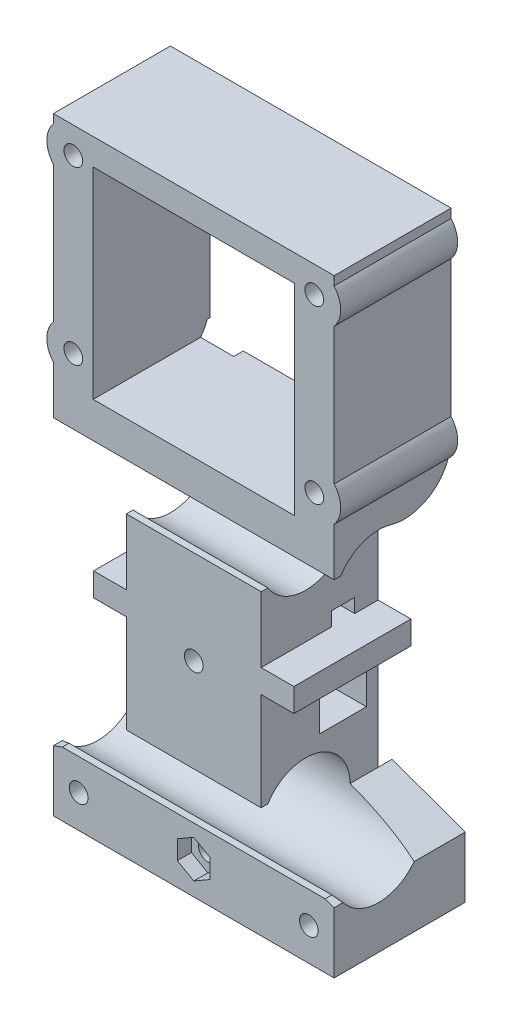
from build123d import *

# Parameters (mm, degrees)
SKETCH_1_W          = 60
SKETCH_1_H          = 130
EXTRUDE_1_DEPTH     = 25
SKETCH_2_W          = 43
SKETCH_2_H          = 43
CUT_EXTRUDE_1_DEPTH = 76.828754441
SKETCH_3_W          = 10
SKETCH_3_H          = 8
CUT_EXTRUDE_2_DEPTH = 92.923881554
FILLET_1_R          = 20
FILLET_2_R          = 10
SKETCH_4_R          = 2
CUT_EXTRUDE_3_DEPTH = 76.828754441
EXTRUDE_2_REACH     = 77.829
SKETCH_5_R          = 4.25
SKETCH_5_R_2        = 2
SKETCH_6_R          = 2
EXTRUDE_3_DEPTH     = 25
CUT_EXTRUDE_4_DEPTH = 5
SKETCH_8_R          = 2
CUT_EXTRUDE_5_DEPTH = 20
CUT_EXTRUDE_6_DEPTH = 3
SKETCH_11_W         = 7
SKETCH_11_H         = 5
EXTRUDE_5_DEPTH     = 7
SKETCH_12_W         = 7
SKETCH_12_H         = 5
EXTRUDE_6_DEPTH     = 7
SKETCH_13_W         = 7
SKETCH_13_H         = 5
EXTRUDE_7_DEPTH     = 4
SKETCH_17_W         = 7
SKETCH_17_H         = 5
EXTRUDE_8_DEPTH     = 14
EXTRUDE_9_DEPTH     = 3
SKETCH_19_W         = 5
SKETCH_19_H         = 3
CUT_EXTRUDE_7_DEPTH = 84.352504546
SKETCH_20_W         = 15
SKETCH_20_H         = 10
CUT_EXTRUDE_8_DEPTH = 13


with BuildPart() as part:
    # Эскиз1 → Бобышка-Вытянуть1 (new body)
    with BuildSketch(Plane.XY):
        Rectangle(SKETCH_1_W, SKETCH_1_H)
    extrude(amount=EXTRUDE_1_DEPTH)

    # Эскиз2 → Вырез-Вытянуть1 (cut, through all)
    with BuildSketch(Plane(origin=(0, 0, 0), x_dir=(-1, 0, 0), z_dir=(0, 0, -1))):
        Polygon((-30, 3.7), (-14.4, 3.7), (-14.4, -46.3), (-30, -52), align=None)
        with Locations((0, 37.85)):
            Rectangle(SKETCH_2_W, SKETCH_2_H)
        Polygon((14.4, -46.3), (30, -52), (30, 3.7), (14.4, 3.7), align=None)
    extrude(amount=-CUT_EXTRUDE_1_DEPTH, mode=Mode.SUBTRACT)

    # Эскиз3 → Вырез-Вытянуть2 (cut, through all)
    with BuildSketch(Plane.ZY.offset(30)):
        with BuildLine():
            Line((23.577747211, 8.7), (25, 8.7))
            Line((25, 8.7), (25, 3.7))
            Line((25, 3.7), (25, -1.3))
            Line((25, -1.3), (23.577747211, -1.3))
            ThreePointArc((23.577747211, -1.3), (6, 3.7), (23.577747211, 8.7))
        make_face()
        with BuildLine():
            Line((25, -41.3), (23.577747211, -41.3))
            ThreePointArc((23.577747211, -41.3), (10.144669889, -38.453316662), (7.9, -52))
            Line((7.9, -52), (23.1, -52))
            ThreePointArc((23.1, -52), (23.346683338, -51.655330111), (23.577747211, -51.3))
            Line((23.577747211, -51.3), (25, -51.3))
            Line((25, -51.3), (25, -46.3))
            Line((25, -46.3), (25, -41.3))
        make_face()
        with Locations((7.5, -29.85)):
            Rectangle(SKETCH_3_W, SKETCH_3_H)
        with BuildLine():
            Line((23.1, -52), (7.9, -52))
            ThreePointArc((7.9, -52), (15.5, -55.8), (23.1, -52))
        make_face()
    extrude(amount=-CUT_EXTRUDE_2_DEPTH, mode=Mode.SUBTRACT)

    # Скругление1
    # the kernel refuses this fillet: 20 mm, written as the material it takes off along each edge
    with BuildSketch(Plane(origin=(-65.707142143, 3.7, 0), x_dir=(0, 1, 0), z_dir=(1, 0, 0))) as fillet_1_piece_1:
        with BuildLine():
            CenterArc((14.282856857, 20), FILLET_1_R, 224.427004001, 45.572995999)
            Line((0, 6), (-0.285657137, 5.72))
            ThreePointArc((-0.285657137, 5.72), (-0.4, 3), (-0.4, 0))
            Line((-0.4, 0), (0, -0.4))
            Line((0, -0.4), (14.282856857, -0.4))
            Line((14.282856857, -0.4), (14.282856857, 0))
        make_face()
    extrude(amount=51.307142143, mode=Mode.SUBTRACT)
    with BuildSketch(Plane(origin=(-65.707142143, 3.7, 0), x_dir=(0, 1, 0), z_dir=(1, 0, 0))) as fillet_1_piece_2_section:
        with BuildLine():
            CenterArc((14.282856857, 20), FILLET_1_R, 224.427004001, 45.572995999)
            Line((0, 6), (-0.285657137, 5.72))
            ThreePointArc((-0.285657137, 5.72), (-0.4, 3), (-0.4, 0))
            Line((-0.4, 0), (0, -0.4))
            Line((0, -0.4), (14.282856857, -0.4))
            Line((14.282856857, -0.4), (14.282856857, 0))
        make_face()
    fillet_1_piece_2 = extrude(amount=87.014284285, mode=Mode.PRIVATE)
    fillet_1_piece_2 = split(fillet_1_piece_2, bisect_by=Plane(origin=(14.4, 3.7, 0), z_dir=(1, 0, 0)), keep=Keep.TOP, mode=Mode.PRIVATE)
    add(fillet_1_piece_2, mode=Mode.SUBTRACT)
    with BuildSketch(Plane(origin=(65.707142143, 3.7, 0), x_dir=(0, 1, 0), z_dir=(-1, 0, 0))) as fillet_1_piece_3:
        with BuildLine():
            CenterArc((14.282856857, -20), FILLET_1_R, 90, 45.572995999)
            Line((0, -6), (-0.285657137, -5.72))
            ThreePointArc((-0.285657137, -5.72), (-0.4, -3), (-0.4, 0))
            Line((-0.4, 0), (0, 0.4))
            Line((0, 0.4), (14.282856857, 0.4))
            Line((14.282856857, 0.4), (14.282856857, 0))
        make_face()
    extrude(amount=51.307142143, mode=Mode.SUBTRACT)
    with BuildSketch(Plane(origin=(65.707142143, 3.7, 0), x_dir=(0, 1, 0), z_dir=(-1, 0, 0))) as fillet_1_piece_4_section:
        with BuildLine():
            CenterArc((14.282856857, -20), FILLET_1_R, 90, 45.572995999)
            Line((0, -6), (-0.285657137, -5.72))
            ThreePointArc((-0.285657137, -5.72), (-0.4, -3), (-0.4, 0))
            Line((-0.4, 0), (0, 0.4))
            Line((0, 0.4), (14.282856857, 0.4))
            Line((14.282856857, 0.4), (14.282856857, 0))
        make_face()
    fillet_1_piece_4 = extrude(amount=87.014284285, mode=Mode.PRIVATE)
    fillet_1_piece_4 = split(fillet_1_piece_4, bisect_by=Plane(origin=(-14.4, 3.7, 0), z_dir=(-1, 0, 0)), keep=Keep.TOP, mode=Mode.PRIVATE)
    add(fillet_1_piece_4, mode=Mode.SUBTRACT)

    # Скругление2
    # the kernel refuses this fillet: 10 mm, written as the material it takes off along each edge
    with BuildSketch(Plane(origin=(-79.117206761, 3.7, 6), x_dir=(-2.6805272160388098e-14, 0.8006407690254324, 0.5991446895152824), z_dir=(1, 0, 0))) as fillet_2_piece_1:
        with BuildLine():
            CenterArc((17.375195996, -8.00640769), FILLET_2_R, 126.808665073, 106.382669854)
            Line((11.383749101, -16.012815381), (10.784604411, -16.81345615))
            ThreePointArc((10.784604411, -16.81345615), (7.241424671, -14.16198322), (-0.991173158, -0.132573646))
            Line((-0.991173158, -0.132573646), (0.59914469, 0.800640769))
            ThreePointArc((0.59914469, 0.800640769), (5.69187455, -0.893912694), (10.784604411, 0.800640769))
            Line((10.784604411, 0.800640769), (11.383749101, 0))
        make_face()
    extrude(amount=64.717206761, mode=Mode.SUBTRACT)
    with BuildSketch(Plane(origin=(-79.117206761, 3.7, 6), x_dir=(-2.6805272160388098e-14, 0.8006407690254324, 0.5991446895152824), z_dir=(1, 0, 0))) as fillet_2_piece_2_section:
        with BuildLine():
            CenterArc((17.375195996, -8.00640769), FILLET_2_R, 126.808665073, 106.382669854)
            Line((11.383749101, -16.012815381), (10.784604411, -16.81345615))
            ThreePointArc((10.784604411, -16.81345615), (7.241424671, -14.16198322), (-0.991173158, -0.132573646))
            Line((-0.991173158, -0.132573646), (0.59914469, 0.800640769))
            ThreePointArc((0.59914469, 0.800640769), (5.69187455, -0.893912694), (10.784604411, 0.800640769))
            Line((10.784604411, 0.800640769), (11.383749101, 0))
        make_face()
    fillet_2_piece_2 = extrude(amount=113.834413522, mode=Mode.PRIVATE)
    fillet_2_piece_2 = split(fillet_2_piece_2, bisect_by=Plane(origin=(14.4, 3.7, 6), z_dir=(1, 0, 0)), keep=Keep.TOP, mode=Mode.PRIVATE)
    add(fillet_2_piece_2, mode=Mode.SUBTRACT)
    with BuildSketch(Plane(origin=(79.117206761, 3.7, 6), x_dir=(9.676973105025612e-15, 0.8006407690254272, 0.5991446895152894), z_dir=(-1, 0, 0))) as fillet_2_piece_3:
        with BuildLine():
            CenterArc((17.375195996, 8.00640769), FILLET_2_R, 126.808665073, 106.382669854)
            Line((11.383749101, 16.012815381), (10.784604411, 16.81345615))
            ThreePointArc((10.784604411, 16.81345615), (7.241424671, 14.16198322), (-0.991173158, 0.132573646))
            Line((-0.991173158, 0.132573646), (0.59914469, -0.800640769))
            ThreePointArc((0.59914469, -0.800640769), (5.69187455, 0.893912694), (10.784604411, -0.800640769))
            Line((10.784604411, -0.800640769), (11.383749101, 0))
        make_face()
    extrude(amount=64.717206761, mode=Mode.SUBTRACT)
    with BuildSketch(Plane(origin=(79.117206761, 3.7, 6), x_dir=(9.676973105025612e-15, 0.8006407690254272, 0.5991446895152894), z_dir=(-1, 0, 0))) as fillet_2_piece_4_section:
        with BuildLine():
            CenterArc((17.375195996, 8.00640769), FILLET_2_R, 126.808665073, 106.382669854)
            Line((11.383749101, 16.012815381), (10.784604411, 16.81345615))
            ThreePointArc((10.784604411, 16.81345615), (7.241424671, 14.16198322), (-0.991173158, 0.132573646))
            Line((-0.991173158, 0.132573646), (0.59914469, -0.800640769))
            ThreePointArc((0.59914469, -0.800640769), (5.69187455, 0.893912694), (10.784604411, -0.800640769))
            Line((10.784604411, -0.800640769), (11.383749101, 0))
        make_face()
    fillet_2_piece_4 = extrude(amount=113.834413522, mode=Mode.PRIVATE)
    fillet_2_piece_4 = split(fillet_2_piece_4, bisect_by=Plane(origin=(-14.4, 3.7, 6), z_dir=(-1, 0, 0)), keep=Keep.TOP, mode=Mode.PRIVATE)
    add(fillet_2_piece_4, mode=Mode.SUBTRACT)

    # Эскиз4 → Вырез-Вытянуть3 (cut, through all)
    with BuildSketch(Plane(origin=(0, 0, 0), x_dir=(-1, 0, 0), z_dir=(0, 0, -1))):
        with Locations((-24.6, -58)):
            Circle(SKETCH_4_R)
        with Locations((24.6, -58)):
            Circle(SKETCH_4_R)
        with Locations((0, -21.3)):
            Circle(SKETCH_4_R)
        with Locations((-25.75, 22.7)):
            Circle(SKETCH_4_R)
        with Locations((25.75, 22.7)):
            Circle(SKETCH_4_R)
        with Locations((25.75, 59.35)):
            Circle(SKETCH_4_R)
        with Locations((-25.75, 59.35)):
            Circle(SKETCH_4_R)
    extrude(amount=-CUT_EXTRUDE_3_DEPTH, mode=Mode.SUBTRACT)

    # Эскиз5 → Бобышка-Вытянуть2 (add, up to next)
    with BuildSketch(Plane(origin=(0, 0, 0), x_dir=(-1, 0, 0), z_dir=(0, 0, -1)), mode=Mode.PRIVATE) as extrude_2_sk1:
        with Locations((25.75, 22.7)):
            Circle(SKETCH_5_R)
        with Locations((25.75, 22.7)):
            Circle(SKETCH_5_R_2, mode=Mode.SUBTRACT)
    extrude_2_tool1 = extrude(extrude_2_sk1.sketch, amount=-EXTRUDE_2_REACH, mode=Mode.PRIVATE) - part.part
    # Эскиз5 → Бобышка-Вытянуть2 (add, up to next)
    with BuildSketch(Plane(origin=(0, 0, 0), x_dir=(-1, 0, 0), z_dir=(0, 0, -1)), mode=Mode.PRIVATE) as extrude_2_sk2:
        with Locations((-25.75, 22.7)):
            Circle(SKETCH_5_R)
        with Locations((-25.75, 22.7)):
            Circle(SKETCH_5_R_2, mode=Mode.SUBTRACT)
    extrude_2_tool2 = extrude(extrude_2_sk2.sketch, amount=-EXTRUDE_2_REACH, mode=Mode.PRIVATE) - part.part
    add(extrude_2_tool1.solids().sort_by_distance((-21.620208, 22.7, 0))[0])
    add(extrude_2_tool2.solids().sort_by_distance((29.879792, 22.7, 0))[0])

    # Эскиз6 → Бобышка-Вытянуть3 (add)
    # profile 1 of 4: a face of its own
    with BuildSketch(Plane(origin=(0, 0, 0), x_dir=(-1, 0, 0), z_dir=(0, 0, -1))):
        with BuildLine():
            Line((-21.5, 26.422902094), (-21.5, 18.977097906))
            ThreePointArc((-21.5, 18.977097906), (-31.4, 22.7), (-21.5, 26.422902094))
        make_face()
        with Locations((-25.75, 22.7)):
            Circle(SKETCH_6_R, mode=Mode.SUBTRACT)
    # profile 2 of 4: a face of its own
    with BuildSketch(Plane(origin=(0, 0, 0), x_dir=(-1, 0, 0), z_dir=(0, 0, -1))):
        with BuildLine():
            Line((21.5, 59.35), (20.1, 59.35))
            ThreePointArc((20.1, 59.35), (31.038430769, 61.33871818), (21.5, 55.627097906))
            Line((21.5, 55.627097906), (21.5, 59.35))
        make_face()
        with Locations((25.75, 59.35)):
            Circle(SKETCH_6_R, mode=Mode.SUBTRACT)
    # profile 3 of 4: a face of its own
    with BuildSketch(Plane(origin=(0, 0, 0), x_dir=(-1, 0, 0), z_dir=(0, 0, -1))):
        with BuildLine():
            Line((-21.5, 59.35), (-21.5, 55.627097906))
            ThreePointArc((-21.5, 55.627097906), (-31.038430769, 61.33871818), (-20.1, 59.35))
            Line((-20.1, 59.35), (-21.5, 59.35))
        make_face()
        with Locations((-25.75, 59.35)):
            Circle(SKETCH_6_R, mode=Mode.SUBTRACT)
    # profile 4 of 4: a face of its own
    with BuildSketch(Plane(origin=(0, 0, 0), x_dir=(-1, 0, 0), z_dir=(0, 0, -1))):
        with BuildLine():
            Line((21.5, 26.422902094), (21.5, 18.977097906))
            ThreePointArc((21.5, 18.977097906), (31.4, 22.7), (21.5, 26.422902094))
        make_face()
        with Locations((25.75, 22.7)):
            Circle(SKETCH_6_R, mode=Mode.SUBTRACT)
    extrude(amount=-EXTRUDE_3_DEPTH)

    # Эскиз7 → Вырез-Вытянуть4 (cut)
    with BuildSketch(Plane(origin=(0, 0, 0), x_dir=(-1, 0, 0), z_dir=(0, 0, -1))):
        Polygon((0, -17.258548116), (-3.5, -19.279274058), (-3.5, -23.320725942), (0, -25.341451884), (3.5, -23.320725942), (3.5, -19.279274058), align=None)
        Polygon((-24.6, -53.958548116), (-28.1, -55.979274058), (-28.1, -60.020725942), (-24.6, -62.041451884), (-21.1, -60.020725942), (-21.1, -55.979274058), align=None)
        Polygon((24.6, -53.958548116), (21.1, -55.979274058), (21.1, -60.020725942), (24.6, -62.041451884), (28.1, -60.020725942), (28.1, -55.979274058), align=None)
    extrude(amount=-CUT_EXTRUDE_4_DEPTH, mode=Mode.SUBTRACT)

    # Эскиз8 → Вырез-Вытянуть5 (cut)
    with BuildSketch(Plane.XY.offset(25)):
        with Locations((0, -58)):
            Circle(SKETCH_8_R)
    extrude(amount=-CUT_EXTRUDE_5_DEPTH, mode=Mode.SUBTRACT)

    # Эскиз9 → Вырез-Вытянуть6 (cut)
    with BuildSketch(Plane.XY.offset(25)):
        Polygon((0, -53.958548116), (-3.5, -55.979274058), (-3.5, -60.020725942), (0, -62.041451884), (3.5, -60.020725942), (3.5, -55.979274058), align=None)
    extrude(amount=-CUT_EXTRUDE_6_DEPTH, mode=Mode.SUBTRACT)

    # Эскиз11 → Бобышка-Вытянуть5 (add)
    with BuildSketch(Plane(origin=(14.4, 0, 0), x_dir=(0, 0, -1), z_dir=(1, 0, 0))):
        with Locations((-7.5, -17.85)):
            Rectangle(SKETCH_11_W, SKETCH_11_H)
    extrude(amount=EXTRUDE_5_DEPTH)

    # Эскиз12 → Бобышка-Вытянуть6 (add)
    with BuildSketch(Plane.ZY.offset(14.4)):
        with Locations((7.5, -17.85)):
            Rectangle(SKETCH_12_W, SKETCH_12_H)
    extrude(amount=EXTRUDE_6_DEPTH)

    # Эскиз13 → Бобышка-Вытянуть7 (add)
    with BuildSketch(Plane(origin=(0, 0, 4), x_dir=(-1, 0, 0), z_dir=(0, 0, -1))):
        with Locations((17.9, -17.85)):
            Rectangle(SKETCH_13_W, SKETCH_13_H)
        with Locations((-17.9, -17.85)):
            Rectangle(SKETCH_13_W, SKETCH_13_H)
    extrude(amount=EXTRUDE_7_DEPTH)

    # Эскиз17 → Бобышка-Вытянуть8 (add)
    with BuildSketch(Plane.XY.offset(11)):
        with Locations((17.9, -17.85)):
            Rectangle(SKETCH_17_W, SKETCH_17_H)
        with Locations((-17.9, -17.85)):
            Rectangle(SKETCH_17_W, SKETCH_17_H)
    extrude(amount=EXTRUDE_8_DEPTH)

    # Эскиз18 → Бобышка-Вытянуть9 (add)
    with BuildSketch(Plane(origin=(0, 0, 0), x_dir=(-1, 0, 0), z_dir=(0, 0, -1))):
        Polygon((-30, -52), (-14.4, -46.3), (-14.4, -65), (-30, -65), align=None)
        Polygon((-28.1, -55.979274058), (-24.6, -53.958548116), (-21.1, -55.979274058), (-21.1, -60.020725942), (-24.6, -62.041451884), (-28.1, -60.020725942), align=None, mode=Mode.SUBTRACT)
    extrude(amount=EXTRUDE_9_DEPTH)

    # Эскиз19 → Вырез-Вытянуть7 (cut, through all)
    with BuildSketch(Plane.ZY.offset(14.4)):
        with Locations((7.5, -13.85)):
            Rectangle(SKETCH_19_W, SKETCH_19_H)
    extrude(amount=-CUT_EXTRUDE_7_DEPTH, mode=Mode.SUBTRACT)

    # Эскиз20 → Вырез-Вытянуть8 (cut)
    with BuildSketch(Plane(origin=(0, 0, 0), x_dir=(-1, 0, 0), z_dir=(0, 0, -1))):
        with Locations((0, -12.35)):
            Rectangle(SKETCH_20_W, SKETCH_20_H)
    extrude(amount=-CUT_EXTRUDE_8_DEPTH, mode=Mode.SUBTRACT)


solid = part.part
